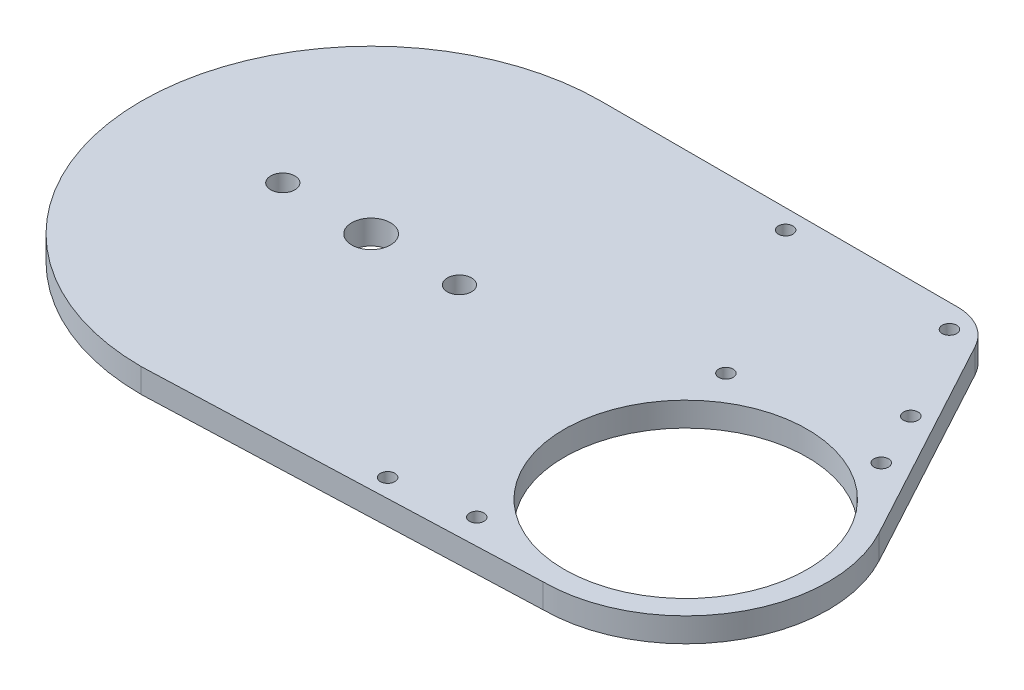
from build123d import *

# Parameters (mm, degrees)
SKETCH1_R           = 25.1
SKETCH1_R_2         = 4
SKETCH1_R_3         = 1.5
SKETCH1_R_4         = 2.5
BOSS_EXTRUDE1_DEPTH = 5


with BuildPart() as part:
    # Sketch1 → Boss-Extrude1 (new body)
    with BuildSketch(Plane(origin=(0, 0, 0), x_dir=(1, 0, 0), z_dir=(0, 1, 0))):
        with BuildLine():
            Line((0, -47.5), (80, -44.5))
            ThreePointArc((80, -44.5), (105.341650726, -30.101348895), (105.945295539, -0.961067014))
            Line((105.945295539, -0.961067014), (82.559049402, 42.258960334))
            ThreePointArc((82.559049402, 42.258960334), (78.883135286, 46.090390077), (73.764033965, 47.5))
            Line((73.764033965, 47.5), (0, 47.5))
            ThreePointArc((0, 47.5), (-47.5, 0), (0, -47.5))
        make_face()
        with Locations((80, -15)):
            Circle(SKETCH1_R, mode=Mode.SUBTRACT)
        Circle(SKETCH1_R_2, mode=Mode.SUBTRACT)
        with Locations((93.688017257, 11.71100727)):
            Circle(SKETCH1_R_3, mode=Mode.SUBTRACT)
        with Locations((61.591696316, 11.71100727)):
            Circle(SKETCH1_R_3, mode=Mode.SUBTRACT)
        with Locations((61.591696316, -39.768646015)):
            Circle(SKETCH1_R_3, mode=Mode.SUBTRACT)
        with Locations((18.25, 0)):
            Circle(SKETCH1_R_4, mode=Mode.SUBTRACT)
        with Locations((-18.25, 0)):
            Circle(SKETCH1_R_4, mode=Mode.SUBTRACT)
        with Locations((76.835494757, 42.654234046)):
            Circle(SKETCH1_R_3, mode=Mode.SUBTRACT)
        with Locations((42.137334928, 43.5)):
            Circle(SKETCH1_R_3, mode=Mode.SUBTRACT)
        with Locations((88.354686129, 23.142870245)):
            Circle(SKETCH1_R_3, mode=Mode.SUBTRACT)
        with Locations((45.293422434, -41.885064382)):
            Circle(SKETCH1_R_3, mode=Mode.SUBTRACT)
    extrude(amount=BOSS_EXTRUDE1_DEPTH)


solid = part.part
